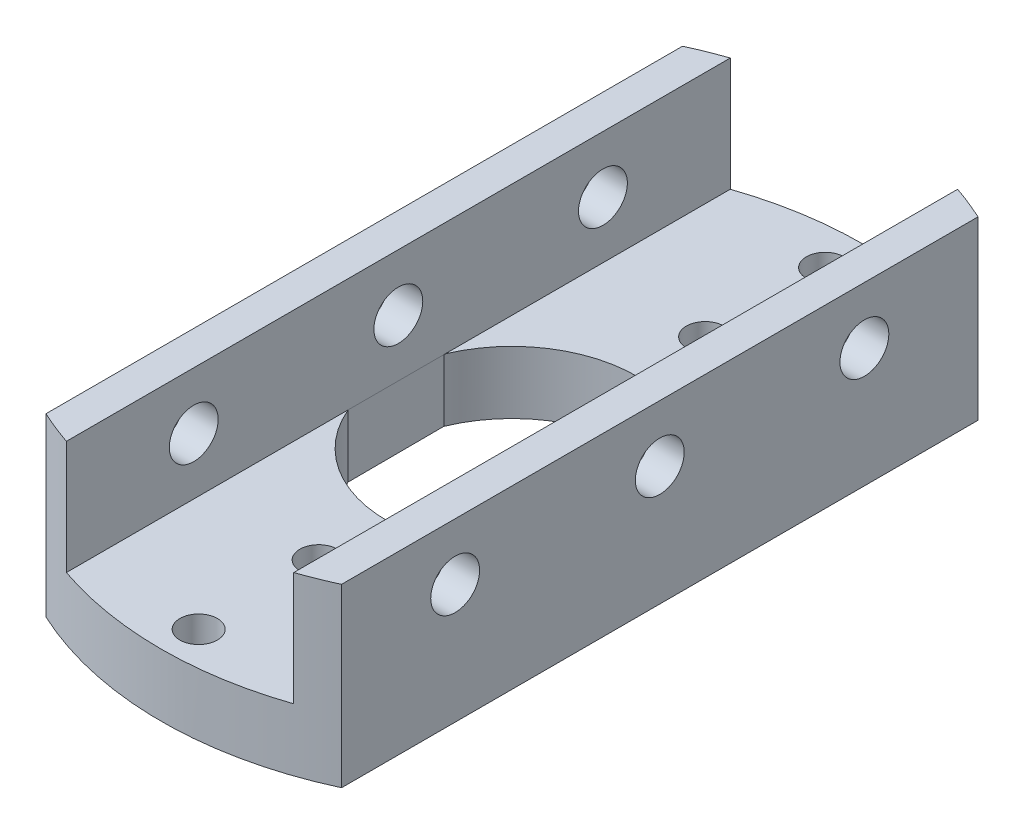
from build123d import *

# Parameters (mm, degrees)
SKETCH1_R                = 28
BOSS_EXTRUDE1_DEPTH      = 3
SKETCH2_R                = 1.625
CUT_EXTRUDE1_DEPTH       = 3
BOSS_EXTRUDE4_START      = 3
BOSS_EXTRUDE4_OUTLINE_R  = 1.625
BOSS_EXTRUDE4_DEPTH      = 70
BOSS_EXTRUDE6_DEPTH      = 7
CUT_EXTRUDE13_START      = -10
CUT_EXTRUDE13_DEPTH      = 10
SKETCH14_R               = 6
CUT_EXTRUDE7_DEPTH       = 4
SKETCH15_R               = 5
CUT_EXTRUDE8_DEPTH       = 37
SKETCH17_R               = 2.15
CUT_EXTRUDE10_DEPTH      = 15.8
CUT_EXTRUDE11_DEPTH      = 5
CUT_EXTRUDE12_START      = -3
CUT_EXTRUDE12_DEPTH      = 3
SKETCH21_W               = 20.621892052
SKETCH21_H               = 10
BOSS_EXTRUDE7_DEPTH      = 7
SKETCH23_R               = 2.15
CUT_EXTRUDE17_DEPTH      = 23
SKETCH25_W               = 2
SKETCH25_H               = 4.7
CUT_EXTRUDE19_DEPTH      = 5
SKETCH26_W               = 20.621892052
SKETCH26_H               = 58
CUT_EXTRUDE21_DEPTH      = 5
CUT_EXTRUDE22_DEPTH      = 5
SKETCH41_R               = 1.625
CUT_EXTRUDE23_DEPTH      = 70
CUT_EXTRUDE24_START      = -39
CUT_EXTRUDE24_DEPTH      = 39
BOSS_EXTRUDE12_START     = -3
SKETCH43_R               = 30.866648668
BOSS_EXTRUDE12_DEPTH     = 3
BOSS_EXTRUDE13_DEPTH     = 70
BOSS_EXTRUDE14_DEPTH     = 70
SKETCH47_R               = 1.65
SKETCH47_R_2             = 1.625
CUT_EXTRUDE26_DEPTH      = 39
SKETCH48_R               = 5
CUT_EXTRUDE27_DEPTH      = 39
SKETCH49_R               = 5
CUT_EXTRUDE28_DEPTH      = 10
CUT_EXTRUDE29_START      = -4
SKETCH50_R               = 6
CUT_EXTRUDE29_DEPTH      = 4
SKETCH51_R               = 3
CUT_EXTRUDE30_DEPTH      = 2.5
CUT_EXTRUDE31_DEPTH      = 81
CUT_EXTRUDE31_DEPTH_BACK = 10
BOSS_EXTRUDE15_DEPTH     = 10
CUT_EXTRUDE32_DEPTH      = 28
CUT_EXTRUDE32_DEPTH_BACK = 12
SKETCH54_R               = 2.15
SKETCH55_R               = 1.65
BOSS_EXTRUDE16_DEPTH     = 2.5
CUT_EXTRUDE33_DEPTH      = 10


# Read off the part's stored shape, not the designer's step: Boss-Extrude4, Cut-Extrude13
with BuildPart() as part:
    # Sketch1 → Boss-Extrude1 (new body)
    with BuildSketch(Plane(origin=(0, 0, 0), x_dir=(1, 0, 0), z_dir=(0, 1, 0))):
        with Locations(Location((20, 12.5, 0), (0, 0, 270))):
            Circle(SKETCH1_R)
    extrude(amount=BOSS_EXTRUDE1_DEPTH)

    # Sketch2 → Cut-Extrude1 (cut)
    with BuildSketch(Plane(origin=(0, 3, 0), x_dir=(1, 0, 0), z_dir=(0, 1, 0))):
        with Locations(Location((20, 19.5, 0), (0, 0, 270))):
            Circle(SKETCH2_R)
        with Locations(Location((20, 5.5, 0), (0, 0, 270))):
            Circle(SKETCH2_R)
        with Locations(Location((20, 12.5, 0), (0, 0, 270))):
            Circle(SKETCH2_R)
    extrude(amount=-CUT_EXTRUDE1_DEPTH, mode=Mode.SUBTRACT)

    # Boss-Extrude4 outline → Boss-Extrude4 (add)
    with BuildSketch(Plane(origin=(0, 0, 0), x_dir=(1, 0, 0), z_dir=(0, 1, 0)).offset(BOSS_EXTRUDE4_START)):
        with BuildLine():
            ThreePointArc((3.5, -10.121892052), (48, 12.5), (3.5, 35.121892052))
            Line((3.5, 35.121892052), (3.5, -10.121892052))
        make_face()
        with Locations((20, 5.5)):
            Circle(BOSS_EXTRUDE4_OUTLINE_R, mode=Mode.SUBTRACT)
        with Locations((20, 12.5)):
            Circle(BOSS_EXTRUDE4_OUTLINE_R, mode=Mode.SUBTRACT)
        with Locations((20, 19.5)):
            Circle(BOSS_EXTRUDE4_OUTLINE_R, mode=Mode.SUBTRACT)
    extrude(amount=BOSS_EXTRUDE4_DEPTH)

    # Sketch13 → Boss-Extrude6 (add)
    with BuildSketch(Plane.ZY.offset(-3.5)):
        Polygon((-10, 23), (10, 23), (10.121892052, 23), (10.121892052, 15), (10, 15), (-10, 15), (-10.5, 15), (-10.5, 23), align=None)
    extrude(amount=BOSS_EXTRUDE6_DEPTH)

    # Cut-Extrude13 outline → Cut-Extrude13 (cut)
    with BuildSketch(Plane.ZY.offset(-3.5).offset(CUT_EXTRUDE13_START)):
        with BuildLine():
            Line((-10.5, 33), (-10.5, 23))
            Line((-10.5, 23), (10.121892052, 23))
            Line((10.121892052, 23), (10.121892052, 35.792364821))
            ThreePointArc((10.121892052, 35.792364821), (-1.408923961, 43.405043646), (-10.5, 33))
        make_face()
    extrude(amount=CUT_EXTRUDE13_DEPTH, mode=Mode.SUBTRACT)

    # Sketch14 → Cut-Extrude7 (cut)
    with BuildSketch(Plane.ZY.offset(-3.5)):
        with Locations((-22.981333294, 52.283628291)):
            Circle(SKETCH14_R)
    extrude(amount=-CUT_EXTRUDE7_DEPTH, mode=Mode.SUBTRACT)

    # Sketch15 → Cut-Extrude8 (cut)
    with BuildSketch(Plane.ZY.offset(-7.5)):
        with Locations((-22.981333294, 52.283628291)):
            Circle(SKETCH15_R)
    extrude(amount=-CUT_EXTRUDE8_DEPTH, mode=Mode.SUBTRACT)

    # Sketch17 → Cut-Extrude10 (cut)
    with BuildSketch(Plane.ZY.offset(3.5)):
        with Locations((-5, 18.2)):
            Circle(SKETCH17_R)
        with Locations((5, 18.2)):
            Circle(SKETCH17_R)
    extrude(amount=-CUT_EXTRUDE10_DEPTH, mode=Mode.SUBTRACT)

    # Sketch18 → Cut-Extrude11 (cut)
    with BuildSketch(Plane.ZY.offset(3.5)):
        Polygon((-0.189053974, 23), (1, 23), (1, 18), (-1, 18), (-1, 23), align=None)
    extrude(amount=-CUT_EXTRUDE11_DEPTH, mode=Mode.SUBTRACT)

    # Sketch19 → Cut-Extrude12 (cut)
    with BuildSketch(Plane.ZY.offset(-3.5).offset(CUT_EXTRUDE12_START)):
        with BuildLine():
            Line((10.121892052, 63), (10.121892052, 35.792364821))
            ThreePointArc((10.121892052, 35.792364821), (-1.408923961, 43.405043646), (-10.5, 33))
            Line((-10.5, 33), (-10.5, 62))
            Line((-10.5, 62), (-10.5, 63))
            Line((-10.5, 63), (10.121892052, 63))
        make_face()
    extrude(amount=CUT_EXTRUDE12_DEPTH, mode=Mode.SUBTRACT)

    # Sketch21 → Boss-Extrude7 (add)
    with BuildSketch(Plane.ZY.offset(-3.5)):
        with Locations((-0.189053974, 68)):
            Rectangle(SKETCH21_W, SKETCH21_H)
    extrude(amount=BOSS_EXTRUDE7_DEPTH)

    # Sketch23 → Cut-Extrude17 (cut)
    with BuildSketch(Plane.ZY.offset(3.5)):
        with Locations((-5, 67.7)):
            Circle(SKETCH23_R)
        with Locations((5, 67.7)):
            Circle(SKETCH23_R)
    extrude(amount=-CUT_EXTRUDE17_DEPTH, mode=Mode.SUBTRACT)

    # Sketch25 → Cut-Extrude19 (cut)
    with BuildSketch(Plane.ZY.offset(3.5)):
        with Locations((0, 65.35)):
            Rectangle(SKETCH25_W, SKETCH25_H)
    extrude(amount=-CUT_EXTRUDE19_DEPTH, mode=Mode.SUBTRACT)

    # Sketch26 → Cut-Extrude21 (cut)
    with BuildSketch(Plane.ZY.offset(3.5)):
        with Locations((-0.189053974, 44)):
            Rectangle(SKETCH26_W, SKETCH26_H)
    extrude(amount=-CUT_EXTRUDE21_DEPTH, mode=Mode.SUBTRACT)

    # Sketch27 → Cut-Extrude22 (cut)
    with BuildSketch(Plane.ZY.offset(-6.5)):
        Polygon((10.121892052, 63), (-10.5, 63), (-10.5, 33), (10.121892052, 35.792364821), align=None)
    extrude(amount=-CUT_EXTRUDE22_DEPTH, mode=Mode.SUBTRACT)

    # Sketch41 → Cut-Extrude23 (cut)
    with BuildSketch(Plane(origin=(0, 73, 0), x_dir=(1, 0, 0), z_dir=(0, 1, 0))):
        with BuildLine():
            Line((11.5, 39.178643144), (11.5, 10.5))
            Line((11.5, 10.5), (11.5, -14.178643144))
            ThreePointArc((11.5, -14.178643144), (48, 12.5), (11.5, 39.178643144))
        make_face()
        with Locations(Location((20, 5.5, 0), (0, 0, 270))):
            Circle(SKETCH41_R, mode=Mode.SUBTRACT)
        with Locations(Location((20, 12.5, 0), (0, 0, 270))):
            Circle(SKETCH41_R, mode=Mode.SUBTRACT)
        with Locations(Location((20, 19.5, 0), (0, 0, 270))):
            Circle(SKETCH41_R, mode=Mode.SUBTRACT)
    extrude(amount=-CUT_EXTRUDE23_DEPTH, mode=Mode.SUBTRACT)

    # Sketch42 → Cut-Extrude24 (cut)
    with BuildSketch(Plane(origin=(0, 3, 0), x_dir=(1, 0, 0), z_dir=(0, 1, 0)).offset(CUT_EXTRUDE24_START)):
        with BuildLine():
            ThreePointArc((3.5, 35.121892052), (-6.366648668, 12.5), (3.5, -10.121892052))
            ThreePointArc((3.5, -10.121892052), (-8, 12.5), (3.5, 35.121892052))
        make_face()
    extrude(amount=CUT_EXTRUDE24_DEPTH, mode=Mode.SUBTRACT)

    # Sketch43 → Boss-Extrude12 (add)
    with BuildSketch(Plane(origin=(0, 3, 0), x_dir=(1, 0, 0), z_dir=(0, 1, 0)).offset(BOSS_EXTRUDE12_START)):
        with Locations(Location((24.5, 12.5, 0), (0, 0, 270))):
            Circle(SKETCH43_R)
    extrude(amount=BOSS_EXTRUDE12_DEPTH)

    # Sketch45 → Boss-Extrude13 (add)
    with BuildSketch(Plane(origin=(0, 3, 0), x_dir=(1, 0, 0), z_dir=(0, 1, 0))):
        with BuildLine():
            Line((11.5, 40.495535358), (11.5, 39.178643144))
            ThreePointArc((11.5, 39.178643144), (7.336497035, 37.472698946), (3.5, 35.121892052))
            ThreePointArc((3.5, 35.121892052), (7.288985777, 38.12286068), (11.5, 40.495535358))
        make_face()
        with BuildLine():
            Line((11.5, -14.178643144), (11.5, -15.495535358))
            ThreePointArc((11.5, -15.495535358), (7.288985777, -13.12286068), (3.5, -10.121892052))
            ThreePointArc((3.5, -10.121892052), (7.336497035, -12.472698946), (11.5, -14.178643144))
        make_face()
    extrude(amount=BOSS_EXTRUDE13_DEPTH)

    # Sketch46 → Boss-Extrude14 (add)
    with BuildSketch(Plane(origin=(0, 3, 0), x_dir=(1, 0, 0), z_dir=(0, 1, 0))):
        with BuildLine():
            Line((37.5, 40.495535358), (37.5, 12.5))
            Line((37.5, 12.5), (37.5, -15.495535358))
            ThreePointArc((37.5, -15.495535358), (41.711014223, -13.12286068), (45.5, -10.121892052))
            Line((45.5, -10.121892052), (45.5, 12.5))
            Line((45.5, 12.5), (45.5, 35.121892052))
            ThreePointArc((45.5, 35.121892052), (41.711014223, 38.12286068), (37.5, 40.495535358))
        make_face()
    extrude(amount=BOSS_EXTRUDE14_DEPTH)

    # Sketch47 → Cut-Extrude26 (cut)
    with BuildSketch(Plane(origin=(0, 3, 0), x_dir=(1, 0, 0), z_dir=(0, 1, 0))):
        with Locations(Location((24.638783134, 29.352080003, 0), (0, 0, 270))):
            Circle(SKETCH47_R)
        with Locations(Location((24.638783134, 19.352080003, 0), (0, 0, 270))):
            Circle(SKETCH47_R)
        with Locations(Location((24.638783134, 12.352080003, 0), (0, 0, 270))):
            Circle(SKETCH47_R)
        with Locations(Location((24.638783134, -4.647919997, 0), (0, 0, 270))):
            Circle(SKETCH47_R)
        with Locations(Location((24.638783134, 5.352080003, 0), (0, 0, 270))):
            Circle(SKETCH47_R)
        with Locations(Location((48.503562926, 26.13041704, 0), (0, 0, 270))):
            Circle(SKETCH47_R)
        with Locations(Location((48.503562926, -1.426257034, 0), (0, 0, 270))):
            Circle(SKETCH47_R)
        with Locations(Location((24.638783134, -15.204594071, 0), (0, 0, 270))):
            Circle(SKETCH47_R)
        with Locations(Location((0.774003343, -1.426257034, 0), (0, 0, 270))):
            Circle(SKETCH47_R)
        with Locations(Location((0.774003343, 26.13041704, 0), (0, 0, 270))):
            Circle(SKETCH47_R)
        with Locations(Location((24.638783134, 39.908754076, 0), (0, 0, 270))):
            Circle(SKETCH47_R)
        with Locations(Location((-2.490624188, 12.352080003, 0), (0, 0, 270))):
            Circle(SKETCH47_R_2)
        with Locations(Location((51.768190456, 12.352080003, 0), (0, 0, 270))):
            Circle(SKETCH47_R_2)
        with Locations(Location((31.638783134, 12.352080003, 0), (0, 0, 270))):
            Circle(SKETCH47_R)
        with Locations(Location((17.638783134, 12.352080003, 0), (0, 0, 270))):
            Circle(SKETCH47_R)
    extrude(amount=-CUT_EXTRUDE26_DEPTH, mode=Mode.SUBTRACT)

    # Sketch48 → Cut-Extrude27 (cut)
    with BuildSketch(Plane.ZY.offset(-7.5)):
        with Locations((-22.981333294, 52.283628291)):
            Circle(SKETCH48_R)
    extrude(amount=-CUT_EXTRUDE27_DEPTH, mode=Mode.SUBTRACT)

    # Sketch49 → Cut-Extrude28 (cut)
    with BuildSketch(Plane(origin=(45.5, 0, 0), x_dir=(0, 0, -1), z_dir=(1, 0, 0))):
        with Locations((0, 33)):
            Circle(SKETCH49_R)
    extrude(amount=-CUT_EXTRUDE28_DEPTH, mode=Mode.SUBTRACT)

    # Sketch50 → Cut-Extrude29 (cut)
    with BuildSketch(Plane(origin=(45.5, 0, 0), x_dir=(0, 0, -1), z_dir=(1, 0, 0)).offset(CUT_EXTRUDE29_START)):
        with Locations((0, 33)):
            Circle(SKETCH50_R)
        with Locations(Location((22.981333294, 52.283628291, 0), (0, 0, 180))):
            Circle(SKETCH50_R)
    extrude(amount=CUT_EXTRUDE29_DEPTH, mode=Mode.SUBTRACT)

    # Sketch51 → Cut-Extrude30 (cut)
    with BuildSketch(Plane(origin=(11.5, 0, 0), x_dir=(0, 0, -1), z_dir=(1, 0, 0))):
        with Locations((-5, 18.2)):
            Circle(SKETCH51_R)
        with Locations((5, 18.2)):
            Circle(SKETCH51_R)
        with Locations((-5, 67.7)):
            Circle(SKETCH51_R)
        with Locations((5, 67.7)):
            Circle(SKETCH51_R)
    extrude(amount=-CUT_EXTRUDE30_DEPTH, mode=Mode.SUBTRACT)

    # Sketch52 → Cut-Extrude31 (cut, two sides: drawn at the far end of the back side and taken through both)
    with BuildSketch(Plane(origin=(0, 3, 0), x_dir=(1, 0, 0), z_dir=(0, 1, 0)).offset(-CUT_EXTRUDE31_DEPTH_BACK)):
        with BuildLine():
            Line((11.5, 40.495535358), (11.5, -15.495535358))
            ThreePointArc((11.5, -15.495535358), (-6.366648668, 12.5), (11.5, 40.495535358))
        make_face()
        with BuildLine():
            Line((37.5, 40.495535358), (37.5, -15.495535358))
            ThreePointArc((37.5, -15.495535358), (55.366648668, 12.5), (37.5, 40.495535358))
        make_face()
    extrude(amount=CUT_EXTRUDE31_DEPTH + CUT_EXTRUDE31_DEPTH_BACK, mode=Mode.SUBTRACT)


with BuildPart() as body_2:
    # of the pieces the cut leaves, the one that is kept (cut_extrude31_keep)
    add(part.part.solids().sort_by_distance((11.5, 0, 15.495535358))[0])

    # Sketch53 → Boss-Extrude15 (add)
    with BuildSketch(Plane(origin=(0, 3, 0), x_dir=(1, 0, 0), z_dir=(0, 1, 0))):
        with BuildLine():
            ThreePointArc((14.5, 41.701883501), (12.984192648, 41.138019852), (11.5, 40.495535358))
            Line((11.5, 40.495535358), (11.5, -15.495535358))
            ThreePointArc((11.5, -15.495535358), (12.984192648, -16.138019852), (14.5, -16.701883501))
            Line((14.5, -16.701883501), (14.5, 12.5))
            Line((14.5, 12.5), (14.5, 41.701883501))
        make_face()
        with BuildLine():
            ThreePointArc((37.5, 40.495535358), (36.015807352, 41.138019852), (34.5, 41.701883501))
            Line((34.5, 41.701883501), (34.5, 12.5))
            Line((34.5, 12.5), (34.5, -16.701883501))
            ThreePointArc((34.5, -16.701883501), (36.015807352, -16.138019852), (37.5, -15.495535358))
            Line((37.5, -15.495535358), (37.5, 40.495535358))
        make_face()
    extrude(amount=BOSS_EXTRUDE15_DEPTH)

    # Sketch54 → Cut-Extrude32 (cut, two sides: drawn at the far end of the back side and taken through both)
    with BuildSketch(Plane(origin=(14.5, 0, 0), x_dir=(0, 0, -1), z_dir=(1, 0, 0)).offset(-CUT_EXTRUDE32_DEPTH_BACK)):
        with Locations(Location((-5.5, 8, 0), (0, 0, 180))):
            Circle(SKETCH54_R)
        with Locations(Location((12.5, 8, 0), (0, 0, 180))):
            Circle(SKETCH54_R)
        with Locations(Location((30.5, 8, 0), (0, 0, 180))):
            Circle(SKETCH54_R)
    extrude(amount=CUT_EXTRUDE32_DEPTH + CUT_EXTRUDE32_DEPTH_BACK, mode=Mode.SUBTRACT)

    # Sketch55 → Boss-Extrude16 (add)
    with BuildSketch(Plane.XZ):
        with BuildLine():
            Line((11.5, 15.495535358), (11.5, -40.495535358))
            ThreePointArc((11.5, -40.495535358), (24.5, -43.366648668), (37.5, -40.495535358))
            Line((37.5, -40.495535358), (37.5, 15.495535358))
            ThreePointArc((37.5, 15.495535358), (24.5, 18.366648668), (11.5, 15.495535358))
        make_face()
        with Locations(Location((17.638783134, -12.352080003, 0), (0, 0, 90))):
            Circle(SKETCH55_R, mode=Mode.SUBTRACT)
        with Locations(Location((24.638783134, 15.204594071, 0), (0, 0, 90))):
            Circle(SKETCH55_R, mode=Mode.SUBTRACT)
        with Locations(Location((24.638783134, 4.647919997, 0), (0, 0, 90))):
            Circle(SKETCH55_R, mode=Mode.SUBTRACT)
        with Locations(Location((24.638783134, -5.352080003, 0), (0, 0, 90))):
            Circle(SKETCH55_R, mode=Mode.SUBTRACT)
        with Locations(Location((24.638783134, -12.352080003, 0), (0, 0, 90))):
            Circle(SKETCH55_R, mode=Mode.SUBTRACT)
        with Locations(Location((31.638783134, -12.352080003, 0), (0, 0, 90))):
            Circle(SKETCH55_R, mode=Mode.SUBTRACT)
        with Locations(Location((24.638783134, -19.352080003, 0), (0, 0, 90))):
            Circle(SKETCH55_R, mode=Mode.SUBTRACT)
        with Locations(Location((24.638783134, -29.352080003, 0), (0, 0, 90))):
            Circle(SKETCH55_R, mode=Mode.SUBTRACT)
    extrude(amount=BOSS_EXTRUDE16_DEPTH)

    # Sketch56 → Cut-Extrude33 (cut)
    with BuildSketch(Plane(origin=(0, 3, 0), x_dir=(1, 0, 0), z_dir=(0, 1, 0))):
        with BuildLine():
            Line((14.5, 8.085339261), (14.464347058, 16.533090711))
            ThreePointArc((14.464347058, 16.533090711), (24.258515067, 23.345505138), (34.5, 17.226133955))
            Line((34.5, 17.226133955), (34.5, 7.478026051))
            ThreePointArc((34.5, 7.478026051), (24.304914759, 1.357147902), (14.5, 8.085339261))
        make_face()
    extrude(amount=-CUT_EXTRUDE33_DEPTH, mode=Mode.SUBTRACT)


solid = body_2.part
